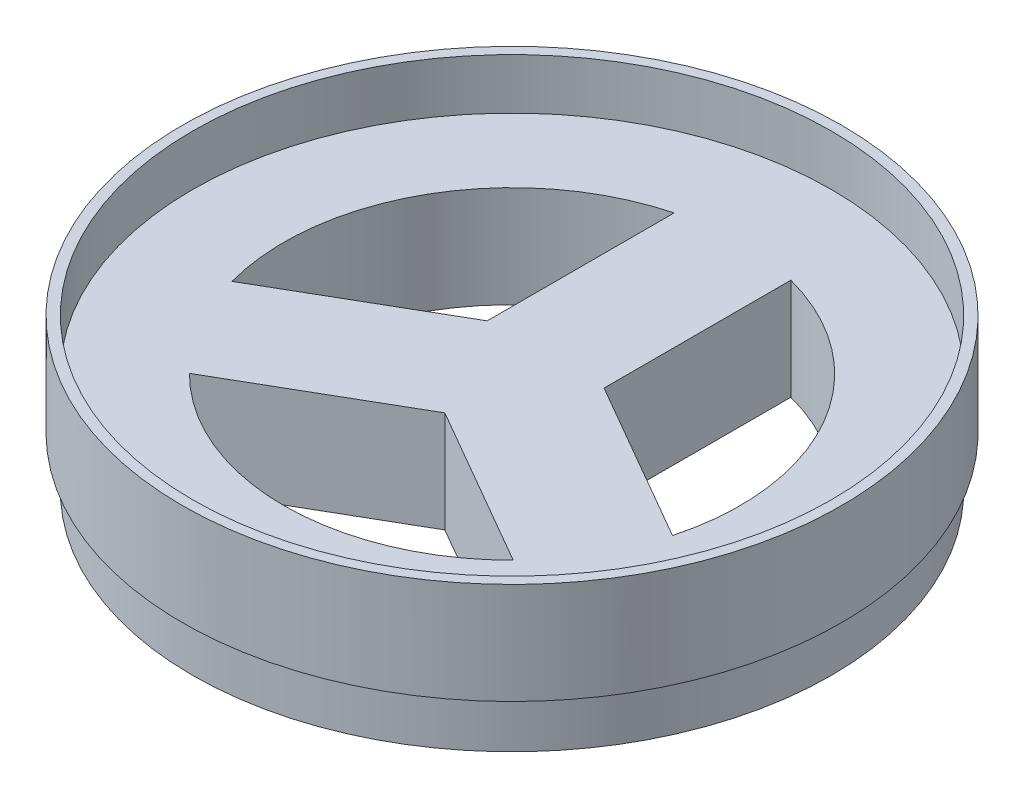
from build123d import *

# Parameters (mm, degrees)
SZKIC1_R                    = 65
DODANIE_WYCI_GNI_CIE1_DEPTH = 20
SZKIC3_R                    = 65
SZKIC3_R_2                  = 63
DODANIE_WYCI_GNI_CIE2_DEPTH = 10
SZKIC6_R                    = 65
SZKIC6_R_2                  = 63
WYTNIJ_WYCI_GNI_CIE1_DEPTH  = 10


with BuildPart() as part:
    # Szkic1 → Dodanie-wyciągnięcie1 (new body)
    with BuildSketch(Plane(origin=(0, 0, 0), x_dir=(1, 0, 0), z_dir=(0, 1, 0))):
        Circle(SZKIC1_R)
        with BuildLine():
            Line((-31.916956587, -31.722356189), (0.027776069, -13.279056191))
            Line((0.027776069, -13.279056191), (31.937203092, -31.701972473))
            ThreePointArc((31.937203092, -31.701972473), (0.014365034, -44.999997707), (-31.916956587, -31.722356189))
        make_face(mode=Mode.SUBTRACT)
        with BuildLine():
            Line((-11.513888034, 6.615473315), (-43.423315058, -11.807442967))
            ThreePointArc((-43.423315058, -11.807442967), (-38.978323702, 22.487558369), (-11.513888034, 43.502073311))
            Line((-11.513888034, 43.502073311), (-11.513888034, 6.615473315))
        make_face(mode=Mode.SUBTRACT)
        with BuildLine():
            Line((11.486111966, 6.663582877), (11.486111966, 43.50941544))
            ThreePointArc((11.486111966, 43.50941544), (38.963958668, 22.512439338), (43.430844622, -11.779717121))
            Line((43.430844622, -11.779717121), (11.486111966, 6.663582877))
        make_face(mode=Mode.SUBTRACT)
    extrude(amount=DODANIE_WYCI_GNI_CIE1_DEPTH)

    # Szkic3 → Dodanie-wyciągnięcie2 (add)
    with BuildSketch(Plane(origin=(0, 20, 0), x_dir=(1, 0, 0), z_dir=(0, 1, 0))):
        Circle(SZKIC3_R)
        Circle(SZKIC3_R_2, mode=Mode.SUBTRACT)
    extrude(amount=DODANIE_WYCI_GNI_CIE2_DEPTH)

    # Szkic6 → Wytnij-wyciągnięcie1 (cut)
    with BuildSketch(Plane.XZ):
        Circle(SZKIC6_R)
        Circle(SZKIC6_R_2, mode=Mode.SUBTRACT)
    extrude(amount=-WYTNIJ_WYCI_GNI_CIE1_DEPTH, mode=Mode.SUBTRACT)


solid = part.part
